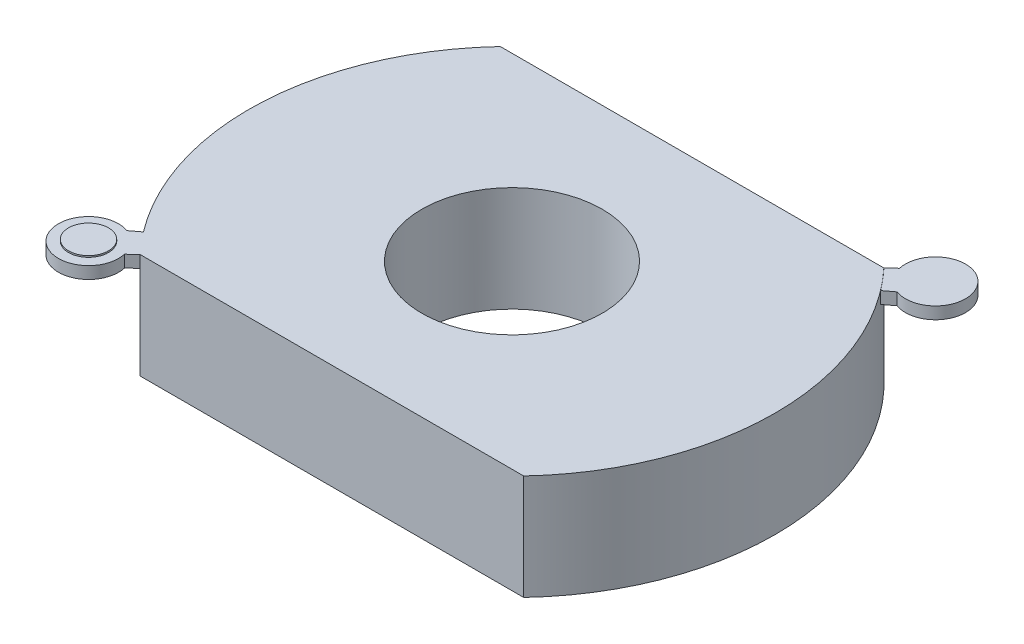
from build123d import *

# Parameters (mm, degrees)
SKETCH1_R                = 1750
BOSS_EXTRUDE1_DEPTH      = 700
CUT_EXTRUDE10_DEPTH      = 2572.964229922
CUT_EXTRUDE10_DEPTH_BACK = 2572.964229922
SKETCH9_W                = 5273.235769222
SKETCH9_H                = 4165.824449254
SKETCH9_W_2              = 4212.623718326
SKETCH9_H_2              = 2396.11984
CUT_EXTRUDE3_DEPTH       = 2234.348958831
CUT_EXTRUDE3_DEPTH_BACK  = 2234.348958831
SKETCH3_R                = 600
SHELL1_T                 = -1.5
BOSS_EXTRUDE2_START      = -80
BOSS_EXTRUDE2_DEPTH      = 80
BOSS_EXTRUDE3_DEPTH      = 80
BOSS_EXTRUDE4_DEPTH      = 50
SKETCH14_R               = 132.8125
BOSS_EXTRUDE5_DEPTH      = 10


with BuildPart() as part:
    # Sketch1 → Boss-Extrude1 (new body)
    with BuildSketch(Plane(origin=(0, 0, 0), x_dir=(1, 0, 0), z_dir=(0, 1, 0))):
        Circle(SKETCH1_R)
    extrude(amount=BOSS_EXTRUDE1_DEPTH)

    # Sketch9 → Cut-Extrude10 (cut, two sides: drawn at the far end of the back side and taken through both)
    with BuildSketch(Plane.XZ.offset(-CUT_EXTRUDE10_DEPTH_BACK)):
        Rectangle(SKETCH9_W, SKETCH9_H)
        Rectangle(SKETCH9_W_2, SKETCH9_H_2, mode=Mode.SUBTRACT)
    extrude(amount=CUT_EXTRUDE10_DEPTH + CUT_EXTRUDE10_DEPTH_BACK, mode=Mode.SUBTRACT)

    # Sketch3 → Cut-Extrude3 (cut, two sides: drawn at the far end of the back side and taken through both)
    with BuildSketch(Plane.XZ.offset(-CUT_EXTRUDE3_DEPTH_BACK)):
        Circle(SKETCH3_R)
    extrude(amount=CUT_EXTRUDE3_DEPTH + CUT_EXTRUDE3_DEPTH_BACK, mode=Mode.SUBTRACT)

    # Shell1
    shell1_openings = [part.faces().sort_by_distance(p)[0] for p in [
        (1707.583740986, 0, 0),
    ]]
    offset(amount=SHELL1_T, openings=shell1_openings, kind=Kind.INTERSECTION)

    # Sketch12 → Boss-Extrude2 (add)
    with BuildSketch(Plane(origin=(0, 700, 0), x_dir=(1, 0, 0), z_dir=(0, 1, 0)).offset(BOSS_EXTRUDE2_START)):
        with BuildLine():
            Line((-1329.427366657, -1248.362496346), (-1275.720428066, -1197.93046101))
            ThreePointArc((-1275.720428066, -1197.93046101), (-1337.090701529, -1129.021016582), (-1394.743394808, -1056.972498526))
            Line((-1394.743394808, -1056.972498526), (-1456.886660309, -1104.066267063))
            ThreePointArc((-1456.886660309, -1104.066267063), (-1674.443216413, -1424.679230146), (-1329.427366657, -1248.362496346))
        make_face()
    extrude(amount=BOSS_EXTRUDE2_DEPTH)

    # Sketch13 → Boss-Extrude4 (add)
    with BuildSketch(Plane(origin=(0, 698.5, 0), x_dir=(-1, 0, 0), z_dir=(0, -1, 0))):
        Polygon((838.224823525, -698.27995814), (994.506973536, -698.27995814), (1038.224823525, -698.27995814), (1038.224823525, -498.27995814), (838.224823525, -498.27995814), align=None)
        with BuildLine():
            ThreePointArc((965.724823525, -598.27995814), (961.964779353, -612.16032187), (951.712860088, -622.244992455))
            ThreePointArc((951.712860088, -622.244992455), (914.484867696, -584.399594411), (965.724823525, -598.27995814))
        make_face(mode=Mode.SUBTRACT)
    extrude(amount=BOSS_EXTRUDE4_DEPTH)

    # Sketch14 → Boss-Extrude5 (add)
    with BuildSketch(Plane(origin=(0, 700, 0), x_dir=(1, 0, 0), z_dir=(0, 1, 0))):
        with Locations((-1524.547349629, -1292.273682222)):
            Circle(SKETCH14_R)
    extrude(amount=BOSS_EXTRUDE5_DEPTH)


with BuildPart() as body_2:
    # Sketch12<6> → Boss-Extrude3 (new body)
    with BuildSketch(Plane(origin=(0, 700, 0), x_dir=(1, 0, 0), z_dir=(0, 1, 0))):
        with BuildLine():
            Line((1329.427366657, 1248.362496346), (1275.858293729, 1198.05992))
            ThreePointArc((1275.858293729, 1198.05992), (1337.197472539, 1129.114373304), (1394.743394808, 1056.972498526))
            Line((1394.743394808, 1056.972498526), (1456.886660309, 1104.066267063))
            ThreePointArc((1456.886660309, 1104.066267063), (1674.443216413, 1424.679230146), (1329.427366657, 1248.362496346))
        make_face()
    extrude(amount=-BOSS_EXTRUDE3_DEPTH)


solid = Compound([part.part, body_2.part])
